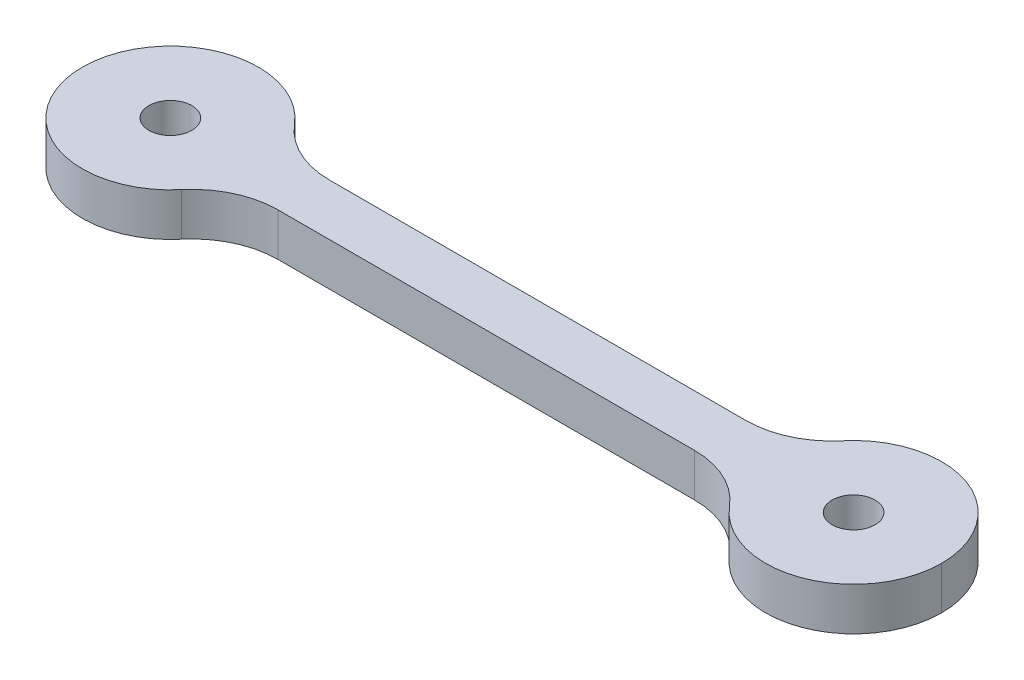
from build123d import *

# Parameters (mm, degrees)
SKETCH1_W           = 100
SKETCH1_H           = 20.5
SKETCH1_R           = 2.5
BOSS_EXTRUDE1_DEPTH = 5
FILLET1_R           = 10.25
CUT_EXTRUDE1_DEPTH  = 10
FILLET2_R           = 10


with BuildPart() as part:
    # Sketch1 → Boss-Extrude1 (new body)
    with BuildSketch(Plane(origin=(0, 0, 0), x_dir=(1, 0, 0), z_dir=(0, 1, 0))):
        with Locations((50, 10.25)):
            Rectangle(SKETCH1_W, SKETCH1_H)
        with Locations(Location((10.25, 10.25, 0), (0, 0, 270))):
            Circle(SKETCH1_R, mode=Mode.SUBTRACT)
        with Locations(Location((89.75, 10.25, 0), (0, 0, 90))):
            Circle(SKETCH1_R, mode=Mode.SUBTRACT)
    extrude(amount=BOSS_EXTRUDE1_DEPTH)

    # Fillet1
    fillet1_edges = [part.edges().sort_by_distance(p)[0] for p in [
        (0, 2.5, 0),
        (0, 2.5, -20.5),
        (100, 2.5, -20.5),
        (100, 2.5, 0),
    ]]
    fillet(fillet1_edges, radius=FILLET1_R - 0.0001)  # a hair under: the kernel refuses the full size

    # Sketch2 → Cut-Extrude1 (cut)
    with BuildSketch(Plane(origin=(0, 5, 0), x_dir=(1, 0, 0), z_dir=(0, 1, 0))):
        with BuildLine():
            Line((20.051147892, 13.25), (79.948852108, 13.25))
            ThreePointArc((79.948852108, 13.25), (83.65440733, 18.490524862), (89.75, 20.5))
            Line((89.75, 20.5), (10.25, 20.5))
            ThreePointArc((10.25, 20.5), (16.34559267, 18.490524862), (20.051147892, 13.25))
        make_face()
        with BuildLine():
            Line((20.051147892, 7.25), (79.948852108, 7.25))
            ThreePointArc((79.948852108, 7.25), (83.65440733, 2.009475138), (89.75, 0))
            Line((89.75, 0), (10.25, 0))
            ThreePointArc((10.25, 0), (16.34559267, 2.009475138), (20.051147892, 7.25))
        make_face()
    extrude(amount=-CUT_EXTRUDE1_DEPTH, mode=Mode.SUBTRACT)

    # Fillet2
    fillet2_edges = [part.edges().sort_by_distance(p)[0] for p in [
        (20.051147892, 2.5, -13.25),
        (79.948852108, 2.5, -13.25),
        (79.948852108, 2.5, -7.25),
        (20.051147892, 2.5, -7.25),
    ]]
    fillet(fillet2_edges, radius=FILLET2_R)


solid = part.part
